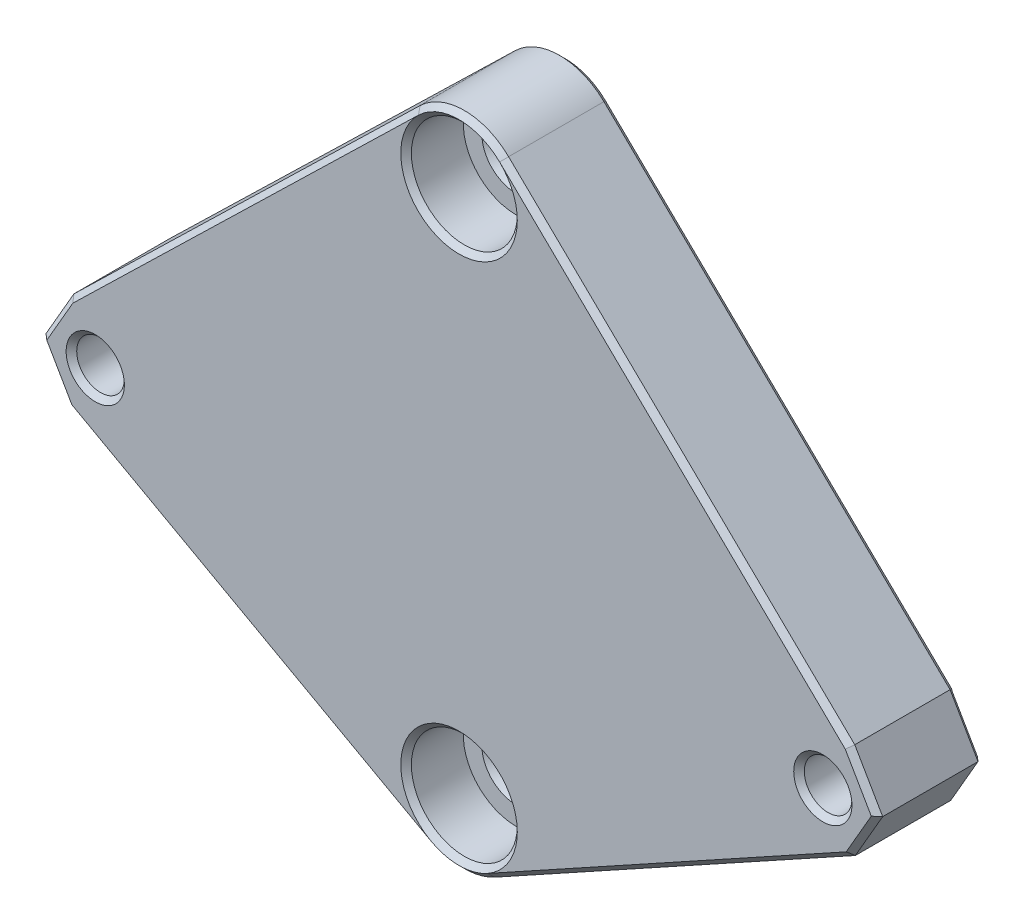
from build123d import *

# Parameters (mm, degrees)
SKETCH1_W                                       = 79
SKETCH1_H                                       = 70
BOSS_EXTRUDE1_DEPTH                             = 10
M4_CLEARANCE_HOLE1_D                            = 4.5
CUT_EXTRUDE3_DEPTH                              = 3.5
CBORE_FOR_M5_SOCKET_HEAD_CAP_SCREW1_D           = 5.5
CBORE_FOR_M5_SOCKET_HEAD_CAP_SCREW1_CBORE_D     = 10
CBORE_FOR_M5_SOCKET_HEAD_CAP_SCREW1_CBORE_DEPTH = 5.4
CUT_EXTRUDE4_DEPTH                              = 10
CHAMFER1_SIZE                                   = 0.5
CHAMFER2_SIZE                                   = 0.5


with BuildPart() as part:
    # Sketch1 → Boss-Extrude1 (new body)
    with BuildSketch(Plane.XY):
        with Locations((39.5, 35)):
            Rectangle(SKETCH1_W, SKETCH1_H)
    extrude(amount=BOSS_EXTRUDE1_DEPTH)

    # M4 Clearance Hole1 (through all)
    with Locations(Plane.XY.offset(10)):
        with Locations((5.15, 28), (73.85, 28)):
            Hole(M4_CLEARANCE_HOLE1_D / 2)

    # Sketch11 → Cut-Extrude3 (cut)
    with BuildSketch(Plane(origin=(0, 0, 0), x_dir=(-1, 0, 0), z_dir=(0, 0, -1))):
        Polygon((-69.635343035, 28), (-71.742671517, 31.65), (-75.957328483, 31.65), (-78.064656965, 28), (-75.957328483, 24.35), (-71.742671517, 24.35), align=None)
        Polygon((-9.364656965, 28), (-7.257328483, 24.35), (-3.042671517, 24.35), (-0.935343035, 28), (-3.042671517, 31.65), (-7.257328483, 31.65), align=None)
    extrude(amount=-CUT_EXTRUDE3_DEPTH, mode=Mode.SUBTRACT)

    # CBORE for M5 Socket Head Cap Screw1 (through all)
    with Locations(Plane.XY.offset(10)):
        with Locations((39.5, 60), (39.5, 10)):
            CounterBoreHole(CBORE_FOR_M5_SOCKET_HEAD_CAP_SCREW1_D / 2, CBORE_FOR_M5_SOCKET_HEAD_CAP_SCREW1_CBORE_D / 2, CBORE_FOR_M5_SOCKET_HEAD_CAP_SCREW1_CBORE_DEPTH)

    # Sketch17 → Cut-Extrude4 (cut)
    with BuildSketch(Plane(origin=(0, 0, 0), x_dir=(-1, 0, 0), z_dir=(0, 0, -1))):
        with BuildLine():
            Line((-125.188021535, 28), (-105.497086029, -6.105700744))
            Line((-105.497086029, -6.105700744), (-61.734857215, -30.269232978))
            ThreePointArc((-61.734857215, -30.269232978), (-39.5, -36), (-17.265142785, -30.269232978))
            Line((-17.265142785, -30.269232978), (26.497086029, -6.105700744))
            Line((26.497086029, -6.105700744), (46.188021535, 28))
            Line((46.188021535, 28), (29.223015539, 57.384252336))
            Line((29.223015539, 57.384252336), (-7.453662483, 93.00048866))
            ThreePointArc((-7.453662483, 93.00048866), (-39.5, 106), (-71.546337517, 93.00048866))
            Line((-71.546337517, 93.00048866), (-108.223015539, 57.384252336))
            Line((-108.223015539, 57.384252336), (-125.188021535, 28))
        make_face()
        with BuildLine():
            Line((-76.364414771, 32.564967524), (-43.679957067, 64.304411564))
            ThreePointArc((-43.679957067, 64.304411564), (-39.5, 66), (-35.320042933, 64.304411564))
            Line((-35.320042933, 64.304411564), (-2.635585229, 32.564967524))
            Line((-2.635585229, 32.564967524), (0, 28))
            Line((0, 28), (-2.579673838, 23.531873846))
            Line((-2.579673838, 23.531873846), (-36.599801233, 4.747491351))
            ThreePointArc((-36.599801233, 4.747491351), (-39.5, 4), (-42.400198767, 4.747491351))
            Line((-42.400198767, 4.747491351), (-76.420326162, 23.531873846))
            Line((-76.420326162, 23.531873846), (-79, 28))
            Line((-79, 28), (-76.364414771, 32.564967524))
        make_face(mode=Mode.SUBTRACT)
    extrude(amount=-CUT_EXTRUDE4_DEPTH, mode=Mode.SUBTRACT)

    # Chamfer1
    # the kernel refuses this chamfer: 0.5 mm, written as the material it takes off along each edge
    with BuildSketch(Plane(origin=(39.5, 10, 10), x_dir=(1, 0, 0), z_dir=(0, -1, 0))) as chamfer1_piece_1:
        Polygon((5 + CHAMFER1_SIZE, 0), (5, -CHAMFER1_SIZE), (5, 0), align=None)
    revolve(axis=Axis((39.5, 10, 10), (0, 0, 1)), mode=Mode.SUBTRACT)
    with BuildSketch(Plane(origin=(39.5, 10, 0), x_dir=(-1, 0, 0), z_dir=(0, -1, 0))) as chamfer1_piece_2:
        Polygon((2.75 + CHAMFER1_SIZE, 0), (2.75, -CHAMFER1_SIZE), (2.75, 0), align=None)
    revolve(axis=Axis((39.5, 10, 0), (0, 0, -1)), mode=Mode.SUBTRACT)
    with BuildSketch(Plane(origin=(39.5, 60, 10), x_dir=(1, 0, 0), z_dir=(0, -1, 0))) as chamfer1_piece_3:
        Polygon((5 + CHAMFER1_SIZE, 0), (5, -CHAMFER1_SIZE), (5, 0), align=None)
    revolve(axis=Axis((39.5, 60, 10), (0, 0, 1)), mode=Mode.SUBTRACT)
    with BuildSketch(Plane(origin=(39.5, 60, 0), x_dir=(-1, 0, 0), z_dir=(0, -1, 0))) as chamfer1_piece_4:
        Polygon((2.75 + CHAMFER1_SIZE, 0), (2.75, -CHAMFER1_SIZE), (2.75, 0), align=None)
    revolve(axis=Axis((39.5, 60, 0), (0, 0, -1)), mode=Mode.SUBTRACT)
    with BuildSketch(Plane(origin=(73.85, 28, 10), x_dir=(-1, 0, 0), z_dir=(0, -1, 0))) as chamfer1_piece_5:
        Polygon((2.25 + CHAMFER1_SIZE, 0), (2.25, CHAMFER1_SIZE), (2.25, 0), align=None)
    revolve(axis=Axis((73.85, 28, 10), (0, 0, -1)), mode=Mode.SUBTRACT)
    with BuildSketch(Plane(origin=(75.777405415, 22.418302447, 10), x_dir=(-0.8656979742248806, 0.49981095845564805, 0.02749587661058518), z_dir=(0.49999999999999967, 0.8660254037844388, 0)), Plane(origin=(-0.642920747, 29.113571399, 0), x_dir=(-0.023812127644091078, -0.013747938305293715, 0.9996219169112968), z_dir=(0.5000000000000001, -0.8660254037844387, 0))) as chamfer1_piece_6:
        Polygon((CHAMFER1_SIZE * 0.999621916911, -CHAMFER1_SIZE * 0.0274958766106), (-CHAMFER1_SIZE * 0.0274958766106, -CHAMFER1_SIZE * 0.999621916911), (0, 0), align=None)
    extrude(amount=7.731030664, mode=Mode.SUBTRACT)
    with BuildSketch(Plane(origin=(42.400198767, 4.747491351, 10), x_dir=(-0.4831837085028112, 0.8750871274375402, 0.027495876610585696), z_dir=(0.8754181082198028, 0.4833664611874326, 0)), Plane(origin=(1.45402491, 24.153406499, 10), x_dir=(0.4831837085028113, 0.8750871274375401, 0.027495876610585605), z_dir=(0.8754181082198027, -0.48336646118743265, 0))) as chamfer1_piece_7:
        Polygon((CHAMFER1_SIZE * 0.999621916911, -CHAMFER1_SIZE * 0.0274958766106), (-CHAMFER1_SIZE * 0.0274958766106, -CHAMFER1_SIZE * 0.999621916911), (0, 0), align=None)
    extrude(amount=40.147417552, mode=Mode.SUBTRACT)
    with BuildSketch(Plane(origin=(39.5, 10, 10), x_dir=(-0.48336646118743537, -0.8754181082198011, 0), z_dir=(-0.8754181082198011, 0.48336646118743537, 0))) as chamfer1_piece_8:
        Polygon((6 - CHAMFER1_SIZE, 0), (6, -CHAMFER1_SIZE), (6, 0), align=None)
    revolve(axis=Axis((39.5, 10, 10), (0, 0, 1)), revolution_arc=57.811005445, mode=Mode.SUBTRACT)
    with BuildSketch(Plane(origin=(-0.642920747, 29.113571399, 10), x_dir=(-0.023812127644091095, -0.013747938305293727, -0.9996219169112968), z_dir=(0.5000000000000001, -0.8660254037844387, 0)), Plane(origin=(75.777405415, 22.418302447, 0), x_dir=(-0.8656979742248806, 0.49981095845564805, -0.02749587661058547), z_dir=(0.49999999999999967, 0.8660254037844388, 0))) as chamfer1_piece_9:
        Polygon((CHAMFER1_SIZE * 0.999621916911, CHAMFER1_SIZE * 0.0274958766106), (-CHAMFER1_SIZE * 0.0274958766106, CHAMFER1_SIZE * 0.999621916911), (0, 0), align=None)
    extrude(amount=7.731030664, mode=Mode.SUBTRACT)
    with BuildSketch(Plane(origin=(3.278505976, 33.678538923, 10), x_dir=(-0.023812127644088344, 0.013747938305292137, -0.9996219169112968), z_dir=(-0.5000000000000001, -0.8660254037844387, 0)), Plane(origin=(79.642920747, 26.886428601, 0), x_dir=(-0.865697974224879, -0.49981095845565066, -0.02749587661058581), z_dir=(-0.5000000000000023, 0.8660254037844374, 0))) as chamfer1_piece_10:
        Polygon((CHAMFER1_SIZE * 0.999621916911, CHAMFER1_SIZE * 0.0274958766106), (-CHAMFER1_SIZE * 0.0274958766106, CHAMFER1_SIZE * 0.999621916911), (0, 0), align=None)
    extrude(amount=7.842853445, mode=Mode.SUBTRACT)
    with BuildSketch(Plane(origin=(35.320042933, 64.304411564, 10), x_dir=(-0.019155263960327032, 0.019725594875552394, -0.999621916911297), z_dir=(-0.7174019273843597, -0.6966595112285529, 0)), Plane(origin=(77.286879937, 31.669173817, 0), x_dir=(-0.6963961160487728, -0.7171306898478127, -0.027495876610586643), z_dir=(-0.7174019273843598, 0.6966595112285526, 0))) as chamfer1_piece_11:
        Polygon((CHAMFER1_SIZE * 0.999621916911, CHAMFER1_SIZE * 0.0274958766106), (-CHAMFER1_SIZE * 0.0274958766106, CHAMFER1_SIZE * 0.999621916911), (0, 0), align=None)
    extrude(amount=46.845320018, mode=Mode.SUBTRACT)
    with BuildSketch(Plane(origin=(39.5, 60, 10), x_dir=(0.6966595112285513, 0.7174019273843611, 0), z_dir=(0.7174019273843611, -0.6966595112285513, 0))) as chamfer1_piece_12:
        Polygon((6 - CHAMFER1_SIZE, 0), (6, -CHAMFER1_SIZE), (6, 0), align=None)
    revolve(axis=Axis((39.5, 60, 10), (0, 0, 1)), revolution_arc=88.31921352, mode=Mode.SUBTRACT)
    with BuildSketch(Plane(origin=(77.286879937, 31.669173817, 10), x_dir=(-0.6963961160487728, -0.7171306898478127, 0.027495876610585824), z_dir=(-0.7174019273843598, 0.6966595112285526, 0)), Plane(origin=(35.320042933, 64.304411564, 0), x_dir=(-0.019155263960327015, 0.019725594875552376, 0.999621916911297), z_dir=(-0.7174019273843597, -0.6966595112285529, 0))) as chamfer1_piece_13:
        Polygon((CHAMFER1_SIZE * 0.999621916911, -CHAMFER1_SIZE * 0.0274958766106), (-CHAMFER1_SIZE * 0.0274958766106, -CHAMFER1_SIZE * 0.999621916911), (0, 0), align=None)
    extrude(amount=46.845320018, mode=Mode.SUBTRACT)
    with BuildSketch(Plane(origin=(79.642920747, 26.886428601, 10), x_dir=(-0.865697974224879, -0.49981095845565066, 0.02749587661058518), z_dir=(-0.5000000000000023, 0.8660254037844374, 0)), Plane(origin=(3.278505976, 33.678538923, 0), x_dir=(-0.023812127644088323, 0.013747938305292124, 0.9996219169112968), z_dir=(-0.5000000000000001, -0.8660254037844387, 0))) as chamfer1_piece_14:
        Polygon((CHAMFER1_SIZE * 0.999621916911, -CHAMFER1_SIZE * 0.0274958766106), (-CHAMFER1_SIZE * 0.0274958766106, -CHAMFER1_SIZE * 0.999621916911), (0, 0), align=None)
    extrude(amount=7.842853445, mode=Mode.SUBTRACT)
    with BuildSketch(Plane(origin=(5.15, 28, 10), x_dir=(-1, 0, 0), z_dir=(0, -1, 0))) as chamfer1_piece_15:
        Polygon((2.25 + CHAMFER1_SIZE, 0), (2.25, CHAMFER1_SIZE), (2.25, 0), align=None)
    revolve(axis=Axis((5.15, 28, 10), (0, 0, -1)), mode=Mode.SUBTRACT)
    with BuildSketch(Plane(origin=(39.5, 60, 0), x_dir=(0.6966595112285513, 0.7174019273843611, 0), z_dir=(0.7174019273843611, -0.6966595112285513, 0))) as chamfer1_piece_16:
        Polygon((6 - CHAMFER1_SIZE, 0), (6, CHAMFER1_SIZE), (6, 0), align=None)
    revolve(axis=Axis((39.5, 60, 0), (0, 0, 1)), revolution_arc=88.31921352, mode=Mode.SUBTRACT)
    with BuildSketch(Plane(origin=(1.45402491, 24.153406499, 0), x_dir=(0.4831837085028113, 0.8750871274375401, -0.02749587661058645), z_dir=(0.8754181082198027, -0.48336646118743265, 0)), Plane(origin=(42.400198767, 4.747491351, 0), x_dir=(-0.4831837085028112, 0.8750871274375402, -0.027495876610586435), z_dir=(0.8754181082198028, 0.4833664611874326, 0))) as chamfer1_piece_17:
        Polygon((CHAMFER1_SIZE * 0.999621916911, CHAMFER1_SIZE * 0.0274958766106), (-CHAMFER1_SIZE * 0.0274958766106, CHAMFER1_SIZE * 0.999621916911), (0, 0), align=None)
    extrude(amount=40.147417552, mode=Mode.SUBTRACT)
    with BuildSketch(Plane(origin=(39.5, 10, 0), x_dir=(-0.48336646118743537, -0.8754181082198011, 0), z_dir=(-0.8754181082198011, 0.48336646118743537, 0))) as chamfer1_piece_18:
        Polygon((6 - CHAMFER1_SIZE, 0), (6, CHAMFER1_SIZE), (6, 0), align=None)
    revolve(axis=Axis((39.5, 10, 0), (0, 0, 1)), revolution_arc=57.811005445, mode=Mode.SUBTRACT)
    with BuildSketch(Plane(origin=(72.385592264, 23.236428601, 0), x_dir=(-0.8656979742248802, -0.49981095845564877, -0.02749587661058547), z_dir=(-0.5000000000000004, 0.8660254037844384, 0))) as chamfer1_piece_19_section:
        Polygon((CHAMFER1_SIZE * 0.999621916911, CHAMFER1_SIZE * 0.0274958766106), (-CHAMFER1_SIZE * 0.0274958766106, CHAMFER1_SIZE * 0.999621916911), (0, 0), align=None)
    chamfer1_piece_19 = extrude(amount=6.786339953, mode=Mode.PRIVATE)
    chamfer1_piece_19 = split(chamfer1_piece_19, bisect_by=Plane(origin=(70.550147439, 24.35, 0.167332088), z_dir=(0, 1, 0)), keep=Keep.TOP, mode=Mode.PRIVATE)
    chamfer1_piece_19 = split(chamfer1_piece_19, bisect_by=Plane(origin=(69.039080996, 26.967243853, 0.167332088), z_dir=(0.8660254037844369, -0.5000000000000031, 0)), keep=Keep.TOP, mode=Mode.PRIVATE)
    add(chamfer1_piece_19, mode=Mode.SUBTRACT)
    with BuildSketch(Plane(origin=(68.992422288, 26.886428601, 0), x_dir=(-0.8656979742248786, 0.4998109584556514, -0.027495876610586244), z_dir=(0.5000000000000031, 0.866025403784437, 0))) as chamfer1_piece_20_section:
        Polygon((CHAMFER1_SIZE * 0.999621916911, CHAMFER1_SIZE * 0.0274958766106), (-CHAMFER1_SIZE * 0.0274958766106, CHAMFER1_SIZE * 0.999621916911), (0, 0), align=None)
    chamfer1_piece_20 = extrude(amount=6.786339953, mode=Mode.PRIVATE)
    chamfer1_piece_20 = split(chamfer1_piece_20, bisect_by=Plane(origin=(69.039080996, 29.032756147, 0.167332088), z_dir=(0.8660254037844384, 0.5000000000000004, 0)), keep=Keep.TOP, mode=Mode.PRIVATE)
    chamfer1_piece_20 = split(chamfer1_piece_20, bisect_by=Plane(origin=(70.550147439, 31.65, 0.167332088), z_dir=(0, -1, 0)), keep=Keep.TOP, mode=Mode.PRIVATE)
    add(chamfer1_piece_20, mode=Mode.SUBTRACT)
    with BuildSketch(Plane(origin=(70.456830023, 31.65, 0), x_dir=(0, 0.9996219169112968, -0.027495876610586483), z_dir=(1, 0, 0))) as chamfer1_piece_21_section:
        Polygon((CHAMFER1_SIZE * 0.999621916911, CHAMFER1_SIZE * 0.0274958766106), (-CHAMFER1_SIZE * 0.0274958766106, CHAMFER1_SIZE * 0.999621916911), (0, 0), align=None)
    chamfer1_piece_21 = extrude(amount=6.786339953, mode=Mode.PRIVATE)
    chamfer1_piece_21 = split(chamfer1_piece_21, bisect_by=Plane(origin=(72.338933557, 32.682756147, 0.167332088), z_dir=(0.8660254037844369, -0.5000000000000031, 0)), keep=Keep.TOP, mode=Mode.PRIVATE)
    chamfer1_piece_21 = split(chamfer1_piece_21, bisect_by=Plane(origin=(75.361066443, 32.682756147, 0.167332088), z_dir=(-0.8660254037844393, -0.499999999999999, 0)), keep=Keep.TOP, mode=Mode.PRIVATE)
    add(chamfer1_piece_21, mode=Mode.SUBTRACT)
    with BuildSketch(Plane(origin=(75.314407736, 32.763571399, 0), x_dir=(0.8656979742248809, 0.4998109584556474, -0.02749587661058581), z_dir=(0.499999999999999, -0.8660254037844393, 0))) as chamfer1_piece_22_section:
        Polygon((CHAMFER1_SIZE * 0.999621916911, CHAMFER1_SIZE * 0.0274958766106), (-CHAMFER1_SIZE * 0.0274958766106, CHAMFER1_SIZE * 0.999621916911), (0, 0), align=None)
    chamfer1_piece_22 = extrude(amount=6.786339953, mode=Mode.PRIVATE)
    chamfer1_piece_22 = split(chamfer1_piece_22, bisect_by=Plane(origin=(78.660919005, 29.032756147, 0.167332088), z_dir=(-0.866025403784439, 0.4999999999999994, 0)), keep=Keep.TOP, mode=Mode.PRIVATE)
    chamfer1_piece_22 = split(chamfer1_piece_22, bisect_by=Plane(origin=(77.14985256, 31.65, 0.167332088), z_dir=(0, -1, 0)), keep=Keep.TOP, mode=Mode.PRIVATE)
    add(chamfer1_piece_22, mode=Mode.SUBTRACT)
    with BuildSketch(Plane(origin=(78.707577712, 29.113571399, 0), x_dir=(0.8656979742248807, -0.4998109584556477, -0.02749587661058552), z_dir=(-0.4999999999999994, -0.866025403784439, 0))) as chamfer1_piece_23_section:
        Polygon((CHAMFER1_SIZE * 0.999621916911, CHAMFER1_SIZE * 0.0274958766106), (-CHAMFER1_SIZE * 0.0274958766106, CHAMFER1_SIZE * 0.999621916911), (0, 0), align=None)
    chamfer1_piece_23 = extrude(amount=6.786339953, mode=Mode.PRIVATE)
    chamfer1_piece_23 = split(chamfer1_piece_23, bisect_by=Plane(origin=(77.149852561, 24.35, 0.167332088), z_dir=(0, 1, 0)), keep=Keep.TOP, mode=Mode.PRIVATE)
    chamfer1_piece_23 = split(chamfer1_piece_23, bisect_by=Plane(origin=(78.660919004, 26.967243853, 0.167332088), z_dir=(-0.8660254037844393, -0.499999999999999, 0)), keep=Keep.TOP, mode=Mode.PRIVATE)
    add(chamfer1_piece_23, mode=Mode.SUBTRACT)
    with BuildSketch(Plane(origin=(77.243169977, 24.35, 0), x_dir=(0, -0.9996219169112968, -0.027495876610586292), z_dir=(-1, 0, 0))) as chamfer1_piece_24_section:
        Polygon((CHAMFER1_SIZE * 0.999621916911, CHAMFER1_SIZE * 0.0274958766106), (-CHAMFER1_SIZE * 0.0274958766106, CHAMFER1_SIZE * 0.999621916911), (0, 0), align=None)
    chamfer1_piece_24 = extrude(amount=6.786339953, mode=Mode.PRIVATE)
    chamfer1_piece_24 = split(chamfer1_piece_24, bisect_by=Plane(origin=(72.338933557, 23.317243853, 0.167332088), z_dir=(0.8660254037844384, 0.5000000000000004, 0)), keep=Keep.TOP, mode=Mode.PRIVATE)
    chamfer1_piece_24 = split(chamfer1_piece_24, bisect_by=Plane(origin=(75.361066443, 23.317243853, 0.167332088), z_dir=(-0.866025403784439, 0.4999999999999994, 0)), keep=Keep.TOP, mode=Mode.PRIVATE)
    add(chamfer1_piece_24, mode=Mode.SUBTRACT)
    with BuildSketch(Plane(origin=(6.614407736, 32.763571399, 0), x_dir=(0.8656979742248808, 0.4998109584556476, -0.02749587661058651), z_dir=(0.4999999999999992, -0.8660254037844392, 0))) as chamfer1_piece_25_section:
        Polygon((CHAMFER1_SIZE * 0.999621916911, CHAMFER1_SIZE * 0.0274958766106), (-CHAMFER1_SIZE * 0.0274958766106, CHAMFER1_SIZE * 0.999621916911), (0, 0), align=None)
    chamfer1_piece_25 = extrude(amount=6.786339953, mode=Mode.PRIVATE)
    chamfer1_piece_25 = split(chamfer1_piece_25, bisect_by=Plane(origin=(8.449852561, 31.65, 0.167332088), z_dir=(0, -1, 0)), keep=Keep.TOP, mode=Mode.PRIVATE)
    chamfer1_piece_25 = split(chamfer1_piece_25, bisect_by=Plane(origin=(9.960919004, 29.032756147, 0.167332088), z_dir=(-0.8660254037844382, 0.5000000000000009, 0)), keep=Keep.TOP, mode=Mode.PRIVATE)
    add(chamfer1_piece_25, mode=Mode.SUBTRACT)
    with BuildSketch(Plane(origin=(10.007577712, 29.113571399, 0), x_dir=(0.8656979742248798, -0.4998109584556492, -0.02749587661058651), z_dir=(-0.5000000000000009, -0.8660254037844382, 0))) as chamfer1_piece_26_section:
        Polygon((CHAMFER1_SIZE * 0.999621916911, CHAMFER1_SIZE * 0.0274958766106), (-CHAMFER1_SIZE * 0.0274958766106, CHAMFER1_SIZE * 0.999621916911), (0, 0), align=None)
    chamfer1_piece_26 = extrude(amount=6.786339953, mode=Mode.PRIVATE)
    chamfer1_piece_26 = split(chamfer1_piece_26, bisect_by=Plane(origin=(9.960919004, 26.967243853, 0.167332088), z_dir=(-0.8660254037844392, -0.4999999999999992, 0)), keep=Keep.TOP, mode=Mode.PRIVATE)
    chamfer1_piece_26 = split(chamfer1_piece_26, bisect_by=Plane(origin=(8.449852561, 24.35, 0.167332088), z_dir=(0, 1, 0)), keep=Keep.TOP, mode=Mode.PRIVATE)
    add(chamfer1_piece_26, mode=Mode.SUBTRACT)
    with BuildSketch(Plane(origin=(8.543169977, 24.35, 0), x_dir=(0, -0.9996219169112968, -0.027495876610586292), z_dir=(-1, 0, 0))) as chamfer1_piece_27_section:
        Polygon((CHAMFER1_SIZE * 0.999621916911, CHAMFER1_SIZE * 0.0274958766106), (-CHAMFER1_SIZE * 0.0274958766106, CHAMFER1_SIZE * 0.999621916911), (0, 0), align=None)
    chamfer1_piece_27 = extrude(amount=6.786339953, mode=Mode.PRIVATE)
    chamfer1_piece_27 = split(chamfer1_piece_27, bisect_by=Plane(origin=(6.661066443, 23.317243853, 0.167332088), z_dir=(-0.8660254037844382, 0.5000000000000009, 0)), keep=Keep.TOP, mode=Mode.PRIVATE)
    chamfer1_piece_27 = split(chamfer1_piece_27, bisect_by=Plane(origin=(3.638933557, 23.317243853, 0.167332088), z_dir=(0.8660254037844387, 0.5000000000000001, 0)), keep=Keep.TOP, mode=Mode.PRIVATE)
    add(chamfer1_piece_27, mode=Mode.SUBTRACT)
    with BuildSketch(Plane(origin=(3.685592264, 23.236428601, 0), x_dir=(-0.8656979742248803, -0.4998109584556484, -0.02749587661058664), z_dir=(-0.5000000000000001, 0.8660254037844387, 0))) as chamfer1_piece_28_section:
        Polygon((CHAMFER1_SIZE * 0.999621916911, CHAMFER1_SIZE * 0.0274958766106), (-CHAMFER1_SIZE * 0.0274958766106, CHAMFER1_SIZE * 0.999621916911), (0, 0), align=None)
    chamfer1_piece_28 = extrude(amount=6.786339953, mode=Mode.PRIVATE)
    chamfer1_piece_28 = split(chamfer1_piece_28, bisect_by=Plane(origin=(0.339080996, 26.967243853, 0.167332088), z_dir=(0.8660254037844388, -0.49999999999999983, 0)), keep=Keep.TOP, mode=Mode.PRIVATE)
    chamfer1_piece_28 = split(chamfer1_piece_28, bisect_by=Plane(origin=(1.850147439, 24.35, 0.167332088), z_dir=(0, 1, 0)), keep=Keep.TOP, mode=Mode.PRIVATE)
    add(chamfer1_piece_28, mode=Mode.SUBTRACT)
    with BuildSketch(Plane(origin=(0.292422288, 26.886428601, 0), x_dir=(-0.8656979742248805, 0.49981095845564816, -0.027495876610586473), z_dir=(0.49999999999999983, 0.8660254037844388, 0))) as chamfer1_piece_29_section:
        Polygon((CHAMFER1_SIZE * 0.999621916911, CHAMFER1_SIZE * 0.0274958766106), (-CHAMFER1_SIZE * 0.0274958766106, CHAMFER1_SIZE * 0.999621916911), (0, 0), align=None)
    chamfer1_piece_29 = extrude(amount=6.786339953, mode=Mode.PRIVATE)
    chamfer1_piece_29 = split(chamfer1_piece_29, bisect_by=Plane(origin=(1.850147439, 31.65, 0.167332088), z_dir=(0, -1, 0)), keep=Keep.TOP, mode=Mode.PRIVATE)
    chamfer1_piece_29 = split(chamfer1_piece_29, bisect_by=Plane(origin=(0.339080996, 29.032756147, 0.167332088), z_dir=(0.8660254037844387, 0.5000000000000001, 0)), keep=Keep.TOP, mode=Mode.PRIVATE)
    add(chamfer1_piece_29, mode=Mode.SUBTRACT)
    with BuildSketch(Plane(origin=(1.756830023, 31.65, 0), x_dir=(0, 0.9996219169112968, -0.027495876610586483), z_dir=(1, 0, 0))) as chamfer1_piece_30_section:
        Polygon((CHAMFER1_SIZE * 0.999621916911, CHAMFER1_SIZE * 0.0274958766106), (-CHAMFER1_SIZE * 0.0274958766106, CHAMFER1_SIZE * 0.999621916911), (0, 0), align=None)
    chamfer1_piece_30 = extrude(amount=6.786339953, mode=Mode.PRIVATE)
    chamfer1_piece_30 = split(chamfer1_piece_30, bisect_by=Plane(origin=(6.661066443, 32.682756147, 0.167332088), z_dir=(-0.8660254037844392, -0.4999999999999992, 0)), keep=Keep.TOP, mode=Mode.PRIVATE)
    chamfer1_piece_30 = split(chamfer1_piece_30, bisect_by=Plane(origin=(3.638933557, 32.682756147, 0.167332088), z_dir=(0.8660254037844388, -0.49999999999999983, 0)), keep=Keep.TOP, mode=Mode.PRIVATE)
    add(chamfer1_piece_30, mode=Mode.SUBTRACT)
    with BuildSketch(Plane(origin=(72.385592264, 23.236428601, 0), x_dir=(-0.8656979742248802, -0.49981095845564877, -0.02749587661058547), z_dir=(-0.5000000000000004, 0.8660254037844384, 0))) as chamfer1_piece_31a_section:
        Polygon((CHAMFER1_SIZE * 0.999621916911, CHAMFER1_SIZE * 0.0274958766106), (-CHAMFER1_SIZE * 0.0274958766106, CHAMFER1_SIZE * 0.999621916911), (0, 0), align=None)
    chamfer1_piece_31a = extrude(amount=6.786339953, mode=Mode.PRIVATE)
    chamfer1_piece_31a = split(chamfer1_piece_31a, bisect_by=Plane(origin=(71.890820617, 24.35, 0.161348719), z_dir=(0, -1, 0)), keep=Keep.TOP, mode=Mode.PRIVATE)
    with BuildSketch(Plane(origin=(77.243169977, 24.35, 0), x_dir=(0, -0.9996219169112968, -0.027495876610586292), z_dir=(-1, 0, 0))) as chamfer1_piece_31b_section:
        Polygon((CHAMFER1_SIZE * 0.999621916911, CHAMFER1_SIZE * 0.0274958766106), (-CHAMFER1_SIZE * 0.0274958766106, CHAMFER1_SIZE * 0.999621916911), (0, 0), align=None)
    chamfer1_piece_31b = extrude(amount=6.786339953, mode=Mode.PRIVATE)
    chamfer1_piece_31b = split(chamfer1_piece_31b, bisect_by=Plane(origin=(71.668596967, 24.478300884, 0.161348719), z_dir=(-0.8660254037844384, -0.5000000000000004, 0)), keep=Keep.TOP, mode=Mode.PRIVATE)
    chamfer1_piece_31 = chamfer1_piece_31a & chamfer1_piece_31b
    add(chamfer1_piece_31, mode=Mode.SUBTRACT)
    with BuildSketch(Plane(origin=(72.385592264, 23.236428601, 0), x_dir=(-0.8656979742248802, -0.49981095845564877, -0.02749587661058547), z_dir=(-0.5000000000000004, 0.8660254037844384, 0))) as chamfer1_piece_32a_section:
        Polygon((CHAMFER1_SIZE * 0.999621916911, CHAMFER1_SIZE * 0.0274958766106), (-CHAMFER1_SIZE * 0.0274958766106, CHAMFER1_SIZE * 0.999621916911), (0, 0), align=None)
    chamfer1_piece_32a = extrude(amount=6.786339953, mode=Mode.PRIVATE)
    chamfer1_piece_32a = split(chamfer1_piece_32a, bisect_by=Plane(origin=(69.709417585, 28.128300884, 0.161348719), z_dir=(-0.8660254037844369, 0.5000000000000031, 0)), keep=Keep.TOP, mode=Mode.PRIVATE)
    with BuildSketch(Plane(origin=(68.992422288, 26.886428601, 0), x_dir=(-0.8656979742248786, 0.4998109584556514, -0.027495876610586244), z_dir=(0.5000000000000031, 0.866025403784437, 0))) as chamfer1_piece_32b_section:
        Polygon((CHAMFER1_SIZE * 0.999621916911, CHAMFER1_SIZE * 0.0274958766106), (-CHAMFER1_SIZE * 0.0274958766106, CHAMFER1_SIZE * 0.999621916911), (0, 0), align=None)
    chamfer1_piece_32b = extrude(amount=6.786339953, mode=Mode.PRIVATE)
    chamfer1_piece_32b = split(chamfer1_piece_32b, bisect_by=Plane(origin=(69.709417585, 27.871699116, 0.161348719), z_dir=(-0.8660254037844384, -0.5000000000000004, 0)), keep=Keep.TOP, mode=Mode.PRIVATE)
    chamfer1_piece_32 = chamfer1_piece_32a & chamfer1_piece_32b
    add(chamfer1_piece_32, mode=Mode.SUBTRACT)
    with BuildSketch(Plane(origin=(68.992422288, 26.886428601, 0), x_dir=(-0.8656979742248786, 0.4998109584556514, -0.027495876610586244), z_dir=(0.5000000000000031, 0.866025403784437, 0))) as chamfer1_piece_33a_section:
        Polygon((CHAMFER1_SIZE * 0.999621916911, CHAMFER1_SIZE * 0.0274958766106), (-CHAMFER1_SIZE * 0.0274958766106, CHAMFER1_SIZE * 0.999621916911), (0, 0), align=None)
    chamfer1_piece_33a = extrude(amount=6.786339953, mode=Mode.PRIVATE)
    chamfer1_piece_33a = split(chamfer1_piece_33a, bisect_by=Plane(origin=(71.890820617, 31.65, 0.161348719), z_dir=(0, 1, 0)), keep=Keep.TOP, mode=Mode.PRIVATE)
    with BuildSketch(Plane(origin=(70.456830023, 31.65, 0), x_dir=(0, 0.9996219169112968, -0.027495876610586483), z_dir=(1, 0, 0))) as chamfer1_piece_33b_section:
        Polygon((CHAMFER1_SIZE * 0.999621916911, CHAMFER1_SIZE * 0.0274958766106), (-CHAMFER1_SIZE * 0.0274958766106, CHAMFER1_SIZE * 0.999621916911), (0, 0), align=None)
    chamfer1_piece_33b = extrude(amount=6.786339953, mode=Mode.PRIVATE)
    chamfer1_piece_33b = split(chamfer1_piece_33b, bisect_by=Plane(origin=(71.668596967, 31.521699116, 0.161348719), z_dir=(-0.8660254037844369, 0.5000000000000031, 0)), keep=Keep.TOP, mode=Mode.PRIVATE)
    chamfer1_piece_33 = chamfer1_piece_33a & chamfer1_piece_33b
    add(chamfer1_piece_33, mode=Mode.SUBTRACT)
    with BuildSketch(Plane(origin=(70.456830023, 31.65, 0), x_dir=(0, 0.9996219169112968, -0.027495876610586483), z_dir=(1, 0, 0))) as chamfer1_piece_34a_section:
        Polygon((CHAMFER1_SIZE * 0.999621916911, CHAMFER1_SIZE * 0.0274958766106), (-CHAMFER1_SIZE * 0.0274958766106, CHAMFER1_SIZE * 0.999621916911), (0, 0), align=None)
    chamfer1_piece_34a = extrude(amount=6.786339953, mode=Mode.PRIVATE)
    chamfer1_piece_34a = split(chamfer1_piece_34a, bisect_by=Plane(origin=(76.031403033, 31.521699116, 0.161348719), z_dir=(0.8660254037844393, 0.499999999999999, 0)), keep=Keep.TOP, mode=Mode.PRIVATE)
    with BuildSketch(Plane(origin=(75.314407736, 32.763571399, 0), x_dir=(0.8656979742248809, 0.4998109584556474, -0.02749587661058581), z_dir=(0.499999999999999, -0.8660254037844393, 0))) as chamfer1_piece_34b_section:
        Polygon((CHAMFER1_SIZE * 0.999621916911, CHAMFER1_SIZE * 0.0274958766106), (-CHAMFER1_SIZE * 0.0274958766106, CHAMFER1_SIZE * 0.999621916911), (0, 0), align=None)
    chamfer1_piece_34b = extrude(amount=6.786339953, mode=Mode.PRIVATE)
    chamfer1_piece_34b = split(chamfer1_piece_34b, bisect_by=Plane(origin=(75.809179383, 31.65, 0.161348719), z_dir=(0, 1, 0)), keep=Keep.TOP, mode=Mode.PRIVATE)
    chamfer1_piece_34 = chamfer1_piece_34a & chamfer1_piece_34b
    add(chamfer1_piece_34, mode=Mode.SUBTRACT)
    with BuildSketch(Plane(origin=(78.707577712, 29.113571399, 0), x_dir=(0.8656979742248807, -0.4998109584556477, -0.02749587661058552), z_dir=(-0.4999999999999994, -0.866025403784439, 0))) as chamfer1_piece_35a_section:
        Polygon((CHAMFER1_SIZE * 0.999621916911, CHAMFER1_SIZE * 0.0274958766106), (-CHAMFER1_SIZE * 0.0274958766106, CHAMFER1_SIZE * 0.999621916911), (0, 0), align=None)
    chamfer1_piece_35a = extrude(amount=6.786339953, mode=Mode.PRIVATE)
    chamfer1_piece_35a = split(chamfer1_piece_35a, bisect_by=Plane(origin=(77.990582415, 28.128300884, 0.161348719), z_dir=(0.8660254037844393, 0.499999999999999, 0)), keep=Keep.TOP, mode=Mode.PRIVATE)
    with BuildSketch(Plane(origin=(75.314407736, 32.763571399, 0), x_dir=(0.8656979742248809, 0.4998109584556474, -0.02749587661058581), z_dir=(0.499999999999999, -0.8660254037844393, 0))) as chamfer1_piece_35b_section:
        Polygon((CHAMFER1_SIZE * 0.999621916911, CHAMFER1_SIZE * 0.0274958766106), (-CHAMFER1_SIZE * 0.0274958766106, CHAMFER1_SIZE * 0.999621916911), (0, 0), align=None)
    chamfer1_piece_35b = extrude(amount=6.786339953, mode=Mode.PRIVATE)
    chamfer1_piece_35b = split(chamfer1_piece_35b, bisect_by=Plane(origin=(77.990582415, 27.871699116, 0.161348719), z_dir=(0.866025403784439, -0.4999999999999994, 0)), keep=Keep.TOP, mode=Mode.PRIVATE)
    chamfer1_piece_35 = chamfer1_piece_35a & chamfer1_piece_35b
    add(chamfer1_piece_35, mode=Mode.SUBTRACT)
    with BuildSketch(Plane(origin=(77.243169977, 24.35, 0), x_dir=(0, -0.9996219169112968, -0.027495876610586292), z_dir=(-1, 0, 0))) as chamfer1_piece_36a_section:
        Polygon((CHAMFER1_SIZE * 0.999621916911, CHAMFER1_SIZE * 0.0274958766106), (-CHAMFER1_SIZE * 0.0274958766106, CHAMFER1_SIZE * 0.999621916911), (0, 0), align=None)
    chamfer1_piece_36a = extrude(amount=6.786339953, mode=Mode.PRIVATE)
    chamfer1_piece_36a = split(chamfer1_piece_36a, bisect_by=Plane(origin=(76.031403033, 24.478300884, 0.161348719), z_dir=(0.866025403784439, -0.4999999999999994, 0)), keep=Keep.TOP, mode=Mode.PRIVATE)
    with BuildSketch(Plane(origin=(78.707577712, 29.113571399, 0), x_dir=(0.8656979742248807, -0.4998109584556477, -0.02749587661058552), z_dir=(-0.4999999999999994, -0.866025403784439, 0))) as chamfer1_piece_36b_section:
        Polygon((CHAMFER1_SIZE * 0.999621916911, CHAMFER1_SIZE * 0.0274958766106), (-CHAMFER1_SIZE * 0.0274958766106, CHAMFER1_SIZE * 0.999621916911), (0, 0), align=None)
    chamfer1_piece_36b = extrude(amount=6.786339953, mode=Mode.PRIVATE)
    chamfer1_piece_36b = split(chamfer1_piece_36b, bisect_by=Plane(origin=(75.809179383, 24.35, 0.161348719), z_dir=(0, -1, 0)), keep=Keep.TOP, mode=Mode.PRIVATE)
    chamfer1_piece_36 = chamfer1_piece_36a & chamfer1_piece_36b
    add(chamfer1_piece_36, mode=Mode.SUBTRACT)
    with BuildSketch(Plane(origin=(6.614407736, 32.763571399, 0), x_dir=(0.8656979742248808, 0.4998109584556476, -0.02749587661058651), z_dir=(0.4999999999999992, -0.8660254037844392, 0))) as chamfer1_piece_37a_section:
        Polygon((CHAMFER1_SIZE * 0.999621916911, CHAMFER1_SIZE * 0.0274958766106), (-CHAMFER1_SIZE * 0.0274958766106, CHAMFER1_SIZE * 0.999621916911), (0, 0), align=None)
    chamfer1_piece_37a = extrude(amount=6.786339953, mode=Mode.PRIVATE)
    chamfer1_piece_37a = split(chamfer1_piece_37a, bisect_by=Plane(origin=(7.109179383, 31.65, 0.161348719), z_dir=(0, 1, 0)), keep=Keep.TOP, mode=Mode.PRIVATE)
    with BuildSketch(Plane(origin=(1.756830023, 31.65, 0), x_dir=(0, 0.9996219169112968, -0.027495876610586483), z_dir=(1, 0, 0))) as chamfer1_piece_37b_section:
        Polygon((CHAMFER1_SIZE * 0.999621916911, CHAMFER1_SIZE * 0.0274958766106), (-CHAMFER1_SIZE * 0.0274958766106, CHAMFER1_SIZE * 0.999621916911), (0, 0), align=None)
    chamfer1_piece_37b = extrude(amount=6.786339953, mode=Mode.PRIVATE)
    chamfer1_piece_37b = split(chamfer1_piece_37b, bisect_by=Plane(origin=(7.331403033, 31.521699116, 0.161348719), z_dir=(0.8660254037844392, 0.4999999999999992, 0)), keep=Keep.TOP, mode=Mode.PRIVATE)
    chamfer1_piece_37 = chamfer1_piece_37a & chamfer1_piece_37b
    add(chamfer1_piece_37, mode=Mode.SUBTRACT)
    with BuildSketch(Plane(origin=(6.614407736, 32.763571399, 0), x_dir=(0.8656979742248808, 0.4998109584556476, -0.02749587661058651), z_dir=(0.4999999999999992, -0.8660254037844392, 0))) as chamfer1_piece_38a_section:
        Polygon((CHAMFER1_SIZE * 0.999621916911, CHAMFER1_SIZE * 0.0274958766106), (-CHAMFER1_SIZE * 0.0274958766106, CHAMFER1_SIZE * 0.999621916911), (0, 0), align=None)
    chamfer1_piece_38a = extrude(amount=6.786339953, mode=Mode.PRIVATE)
    chamfer1_piece_38a = split(chamfer1_piece_38a, bisect_by=Plane(origin=(9.290582415, 27.871699116, 0.161348719), z_dir=(0.8660254037844382, -0.5000000000000009, 0)), keep=Keep.TOP, mode=Mode.PRIVATE)
    with BuildSketch(Plane(origin=(10.007577712, 29.113571399, 0), x_dir=(0.8656979742248798, -0.4998109584556492, -0.02749587661058651), z_dir=(-0.5000000000000009, -0.8660254037844382, 0))) as chamfer1_piece_38b_section:
        Polygon((CHAMFER1_SIZE * 0.999621916911, CHAMFER1_SIZE * 0.0274958766106), (-CHAMFER1_SIZE * 0.0274958766106, CHAMFER1_SIZE * 0.999621916911), (0, 0), align=None)
    chamfer1_piece_38b = extrude(amount=6.786339953, mode=Mode.PRIVATE)
    chamfer1_piece_38b = split(chamfer1_piece_38b, bisect_by=Plane(origin=(9.290582415, 28.128300884, 0.161348719), z_dir=(0.8660254037844392, 0.4999999999999992, 0)), keep=Keep.TOP, mode=Mode.PRIVATE)
    chamfer1_piece_38 = chamfer1_piece_38a & chamfer1_piece_38b
    add(chamfer1_piece_38, mode=Mode.SUBTRACT)
    with BuildSketch(Plane(origin=(10.007577712, 29.113571399, 0), x_dir=(0.8656979742248798, -0.4998109584556492, -0.02749587661058651), z_dir=(-0.5000000000000009, -0.8660254037844382, 0))) as chamfer1_piece_39a_section:
        Polygon((CHAMFER1_SIZE * 0.999621916911, CHAMFER1_SIZE * 0.0274958766106), (-CHAMFER1_SIZE * 0.0274958766106, CHAMFER1_SIZE * 0.999621916911), (0, 0), align=None)
    chamfer1_piece_39a = extrude(amount=6.786339953, mode=Mode.PRIVATE)
    chamfer1_piece_39a = split(chamfer1_piece_39a, bisect_by=Plane(origin=(7.109179383, 24.35, 0.161348719), z_dir=(0, -1, 0)), keep=Keep.TOP, mode=Mode.PRIVATE)
    with BuildSketch(Plane(origin=(8.543169977, 24.35, 0), x_dir=(0, -0.9996219169112968, -0.027495876610586292), z_dir=(-1, 0, 0))) as chamfer1_piece_39b_section:
        Polygon((CHAMFER1_SIZE * 0.999621916911, CHAMFER1_SIZE * 0.0274958766106), (-CHAMFER1_SIZE * 0.0274958766106, CHAMFER1_SIZE * 0.999621916911), (0, 0), align=None)
    chamfer1_piece_39b = extrude(amount=6.786339953, mode=Mode.PRIVATE)
    chamfer1_piece_39b = split(chamfer1_piece_39b, bisect_by=Plane(origin=(7.331403033, 24.478300884, 0.161348719), z_dir=(0.8660254037844382, -0.5000000000000009, 0)), keep=Keep.TOP, mode=Mode.PRIVATE)
    chamfer1_piece_39 = chamfer1_piece_39a & chamfer1_piece_39b
    add(chamfer1_piece_39, mode=Mode.SUBTRACT)
    with BuildSketch(Plane(origin=(8.543169977, 24.35, 0), x_dir=(0, -0.9996219169112968, -0.027495876610586292), z_dir=(-1, 0, 0))) as chamfer1_piece_40a_section:
        Polygon((CHAMFER1_SIZE * 0.999621916911, CHAMFER1_SIZE * 0.0274958766106), (-CHAMFER1_SIZE * 0.0274958766106, CHAMFER1_SIZE * 0.999621916911), (0, 0), align=None)
    chamfer1_piece_40a = extrude(amount=6.786339953, mode=Mode.PRIVATE)
    chamfer1_piece_40a = split(chamfer1_piece_40a, bisect_by=Plane(origin=(2.968596967, 24.478300884, 0.161348719), z_dir=(-0.8660254037844387, -0.5000000000000001, 0)), keep=Keep.TOP, mode=Mode.PRIVATE)
    with BuildSketch(Plane(origin=(3.685592264, 23.236428601, 0), x_dir=(-0.8656979742248803, -0.4998109584556484, -0.02749587661058664), z_dir=(-0.5000000000000001, 0.8660254037844387, 0))) as chamfer1_piece_40b_section:
        Polygon((CHAMFER1_SIZE * 0.999621916911, CHAMFER1_SIZE * 0.0274958766106), (-CHAMFER1_SIZE * 0.0274958766106, CHAMFER1_SIZE * 0.999621916911), (0, 0), align=None)
    chamfer1_piece_40b = extrude(amount=6.786339953, mode=Mode.PRIVATE)
    chamfer1_piece_40b = split(chamfer1_piece_40b, bisect_by=Plane(origin=(3.190820617, 24.35, 0.161348719), z_dir=(0, -1, 0)), keep=Keep.TOP, mode=Mode.PRIVATE)
    chamfer1_piece_40 = chamfer1_piece_40a & chamfer1_piece_40b
    add(chamfer1_piece_40, mode=Mode.SUBTRACT)
    with BuildSketch(Plane(origin=(0.292422288, 26.886428601, 0), x_dir=(-0.8656979742248805, 0.49981095845564816, -0.027495876610586473), z_dir=(0.49999999999999983, 0.8660254037844388, 0))) as chamfer1_piece_41a_section:
        Polygon((CHAMFER1_SIZE * 0.999621916911, CHAMFER1_SIZE * 0.0274958766106), (-CHAMFER1_SIZE * 0.0274958766106, CHAMFER1_SIZE * 0.999621916911), (0, 0), align=None)
    chamfer1_piece_41a = extrude(amount=6.786339953, mode=Mode.PRIVATE)
    chamfer1_piece_41a = split(chamfer1_piece_41a, bisect_by=Plane(origin=(1.009417585, 27.871699116, 0.161348719), z_dir=(-0.8660254037844387, -0.5000000000000001, 0)), keep=Keep.TOP, mode=Mode.PRIVATE)
    with BuildSketch(Plane(origin=(3.685592264, 23.236428601, 0), x_dir=(-0.8656979742248803, -0.4998109584556484, -0.02749587661058664), z_dir=(-0.5000000000000001, 0.8660254037844387, 0))) as chamfer1_piece_41b_section:
        Polygon((CHAMFER1_SIZE * 0.999621916911, CHAMFER1_SIZE * 0.0274958766106), (-CHAMFER1_SIZE * 0.0274958766106, CHAMFER1_SIZE * 0.999621916911), (0, 0), align=None)
    chamfer1_piece_41b = extrude(amount=6.786339953, mode=Mode.PRIVATE)
    chamfer1_piece_41b = split(chamfer1_piece_41b, bisect_by=Plane(origin=(1.009417585, 28.128300884, 0.161348719), z_dir=(-0.8660254037844388, 0.49999999999999983, 0)), keep=Keep.TOP, mode=Mode.PRIVATE)
    chamfer1_piece_41 = chamfer1_piece_41a & chamfer1_piece_41b
    add(chamfer1_piece_41, mode=Mode.SUBTRACT)
    with BuildSketch(Plane(origin=(1.756830023, 31.65, 0), x_dir=(0, 0.9996219169112968, -0.027495876610586483), z_dir=(1, 0, 0))) as chamfer1_piece_42a_section:
        Polygon((CHAMFER1_SIZE * 0.999621916911, CHAMFER1_SIZE * 0.0274958766106), (-CHAMFER1_SIZE * 0.0274958766106, CHAMFER1_SIZE * 0.999621916911), (0, 0), align=None)
    chamfer1_piece_42a = extrude(amount=6.786339953, mode=Mode.PRIVATE)
    chamfer1_piece_42a = split(chamfer1_piece_42a, bisect_by=Plane(origin=(2.968596967, 31.521699116, 0.161348719), z_dir=(-0.8660254037844388, 0.49999999999999983, 0)), keep=Keep.TOP, mode=Mode.PRIVATE)
    with BuildSketch(Plane(origin=(0.292422288, 26.886428601, 0), x_dir=(-0.8656979742248805, 0.49981095845564816, -0.027495876610586473), z_dir=(0.49999999999999983, 0.8660254037844388, 0))) as chamfer1_piece_42b_section:
        Polygon((CHAMFER1_SIZE * 0.999621916911, CHAMFER1_SIZE * 0.0274958766106), (-CHAMFER1_SIZE * 0.0274958766106, CHAMFER1_SIZE * 0.999621916911), (0, 0), align=None)
    chamfer1_piece_42b = extrude(amount=6.786339953, mode=Mode.PRIVATE)
    chamfer1_piece_42b = split(chamfer1_piece_42b, bisect_by=Plane(origin=(3.190820617, 31.65, 0.161348719), z_dir=(0, 1, 0)), keep=Keep.TOP, mode=Mode.PRIVATE)
    chamfer1_piece_42 = chamfer1_piece_42a & chamfer1_piece_42b
    add(chamfer1_piece_42, mode=Mode.SUBTRACT)

    # Chamfer2
    chamfer2_edges = [part.edges().sort_by_distance(p)[0] for p in [
        (42.25, 10, 4.6),
        (42.25, 60, 4.6),
    ]]
    chamfer(chamfer2_edges, length=CHAMFER2_SIZE)


solid = part.part
